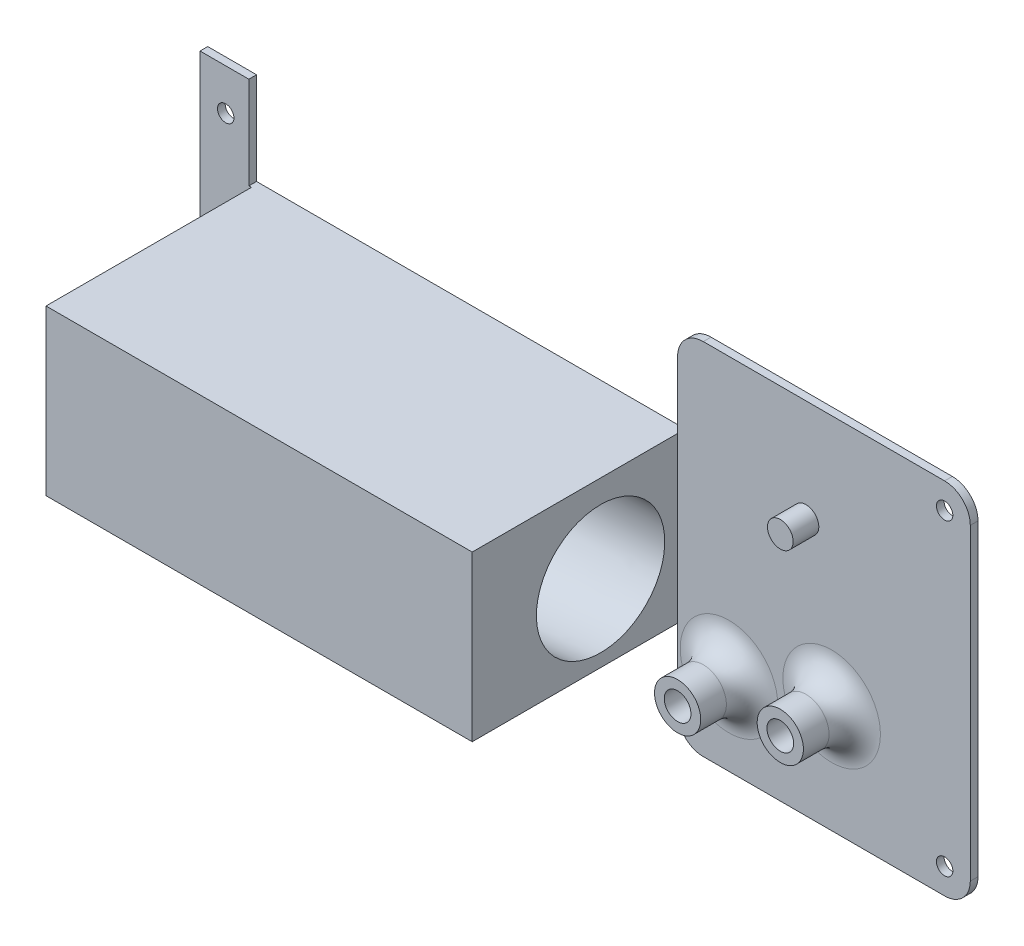
from build123d import *

# Parameters (mm, degrees)
ESQUISSE1_W             = 140
ESQUISSE1_H             = 70
BOSS_EXTRU_1_DEPTH      = 1.5
ESQUISSE2_R             = 1.6
ENL_V_MAT_EXTRU_2_DEPTH = 1.5
ESQUISSE2_4_R           = 2.5
BOSS_EXTRU_2_DEPTH      = 5
BOSS_EXTRU_3_DEPTH      = 40
ESQUISSE11_R            = 4.5
ESQUISSE11_R_2          = 2.6
BOSS_EXTRU_4_DEPTH      = 10
CONG_1_R                = 5
ESQUISSE14_W            = 83
ESQUISSE14_H            = 18
ESQUISSE14_H_2          = 20
ENL_V_MAT_EXTRU_3_DEPTH = 162.554944214
CONG_3_R                = 5
ESQUISSE17_W            = 1.5
ESQUISSE17_H            = 70
BOSS_EXTRU_5_DEPTH      = 10
ESQUISSE18_R            = 1.6
ENL_V_MAT_EXTRU_4_DEPTH = 162.554944239
ESQUISSE22_W            = 1.5
ESQUISSE22_H            = 18
ESQUISSE22_H_2          = 20
ENL_V_MAT_EXTRU_5_DEPTH = 0.5


with BuildPart() as part:
    # Esquisse1 → Boss.-Extru.1 (new body)
    with BuildSketch(Plane.XY):
        with Locations((70, -35)):
            Rectangle(ESQUISSE1_W, ESQUISSE1_H)
    extrude(amount=BOSS_EXTRU_1_DEPTH)

    # Esquisse2 → Enlèv. mat.-Extru.2 (cut)
    with BuildSketch(Plane.XY.offset(1.5)):
        with Locations((135, -5)):
            Circle(ESQUISSE2_R)
        with Locations((135, -65)):
            Circle(ESQUISSE2_R)
    extrude(amount=-ENL_V_MAT_EXTRU_2_DEPTH, mode=Mode.SUBTRACT)

    # Esquisse2<4> → Boss.-Extru.2 (add)
    with BuildSketch(Plane.XY.offset(1.5)):
        with Locations((108, -20)):
            Circle(ESQUISSE2_4_R)
    extrude(amount=BOSS_EXTRU_2_DEPTH)

    # Esquisse2<5> → Boss.-Extru.3 (add)
    with BuildSketch(Plane.XY.offset(1.5)):
        Polygon((83, -18), (0, -18), (0, -50), (7.5, -50), (75, -50), (76.464784117, -50), (83, -50), (83, -45), align=None)
    extrude(amount=BOSS_EXTRU_3_DEPTH)

    # Esquisse11 → Boss.-Extru.4 (add)
    # profile 1 of 2: a face of its own
    with BuildSketch(Plane.XY.offset(1.5)):
        with Locations((113, -49)):
            Circle(ESQUISSE11_R)
        with Locations((113, -49)):
            Circle(ESQUISSE11_R_2, mode=Mode.SUBTRACT)
    # profile 2 of 2: a face of its own
    with BuildSketch(Plane.XY.offset(1.5)):
        with Locations((93, -54)):
            Circle(ESQUISSE11_R)
        with Locations((93, -54)):
            Circle(ESQUISSE11_R_2, mode=Mode.SUBTRACT)
    extrude(amount=BOSS_EXTRU_4_DEPTH)

    # Congé1
    cong_1_edges = [part.edges().sort_by_distance(p)[0] for p in [
        (108.5, -49, 1.5),
        (88.5, -54, 1.5),
    ]]
    fillet(cong_1_edges, radius=CONG_1_R)

    # Esquisse14 → Enlèv. mat.-Extru.3 (cut, through all)
    with BuildSketch(Plane.XY.offset(1.5)):
        with Locations((41.5, -9)):
            Rectangle(ESQUISSE14_W, ESQUISSE14_H)
        with Locations((41.5, -60)):
            Rectangle(ESQUISSE14_W, ESQUISSE14_H_2)
    extrude(amount=-ENL_V_MAT_EXTRU_3_DEPTH, mode=Mode.SUBTRACT)

    # Congé3
    cong_3_edges = [part.edges().sort_by_distance(p)[0] for p in [
        (83, 0, 0.75),
        (140, 0, 0.75),
        (140, -70, 0.75),
        (83, -70, 0.75),
    ]]
    fillet(cong_3_edges, radius=CONG_3_R)

    # Enlèvement de matière-Lissage1: read off the stored shape, not the designer's step
    # Enlèvement de matière-Lissage1: loft between two sections, ruled curve by curve
    enl_vement_de_mati_re_lissage1_from = [
        Edge.make_bspline([(0, -35.358936945, 10.061683817), (0, -34.736507104, 10.005061444), (0, -34.071276467, 9.983471322), (0, -32.656620792, 10.043511569), (0, -31.906986183, 10.125212836), (0, -30.336715689, 10.432215403), (0, -29.515853558, 10.657740433), (0, -27.835171711, 11.295881241), (0, -26.97522752, 11.708928876), (0, -25.273092172, 12.759040897), (0, -24.43107638, 13.396695447), (0, -22.846227272, 14.910682395), (0, -22.104033135, 15.787505474), (0, -20.813231902, 17.754778804), (0, -20.26561628, 18.845205387), (0, -19.446047462, 21.166299645), (0, -19.174928563, 22.396203373), (0, -18.948439072, 24.885922737), (0, -18.993175694, 26.144559807), (0, -19.380457825, 28.575441159), (0, -19.722320583, 29.746783491), (0, -20.636945499, 31.91468419), (0, -21.20873673, 32.91104037), (0, -22.494376602, 34.686155378), (0, -23.207508016, 35.465281495), (0, -24.692213453, 36.805300064), (0, -25.463508496, 37.366741349), (0, -27.001451353, 38.297680084), (0, -27.768143671, 38.667624764), (0, -29.257240332, 39.252937618), (0, -29.979826835, 39.468566674), (0, -31.360426607, 39.782890995), (0, -32.018633214, 39.88169381), (0, -33.263492896, 39.994938556), (0, -33.928723533, 40.016528678), (0, -35.343379208, 39.956488431), (0, -36.093013817, 39.874787164), (0, -37.663284311, 39.567784597), (0, -38.484146442, 39.342259567), (0, -40.164828289, 38.704118759), (0, -41.02477248, 38.291071124), (0, -42.726907828, 37.240959103), (0, -43.56892362, 36.603304553), (0, -45.153772728, 35.089317605), (0, -45.895966865, 34.212494526), (0, -47.186768098, 32.245221196), (0, -47.73438372, 31.154794613), (0, -48.553952538, 28.833700355), (0, -48.825071437, 27.603796627), (0, -49.051560928, 25.114077263), (0, -49.006824306, 23.855440193), (0, -48.619542175, 21.424558841), (0, -48.277679417, 20.253216509), (0, -47.363054501, 18.08531581), (0, -46.79126327, 17.08895963), (0, -45.505623398, 15.313844622), (0, -44.792491984, 14.534718505), (0, -43.307786547, 13.194699936), (0, -42.536491504, 12.633258651), (0, -40.998548647, 11.702319916), (0, -40.231856329, 11.332375236), (0, -38.742759668, 10.747062382), (0, -38.020173165, 10.531433326), (0, -36.639573393, 10.217109005), (0, -35.981366786, 10.11830619), (0, -35.358936945, 10.061683817)], [0, 0, 0, 0, 0.03125, 0.03125, 0.0625, 0.0625, 0.09375, 0.09375, 0.125, 0.125, 0.15625, 0.15625, 0.1875, 0.1875, 0.21875, 0.21875, 0.25, 0.25, 0.28125, 0.28125, 0.3125, 0.3125, 0.34375, 0.34375, 0.375, 0.375, 0.40625, 0.40625, 0.4375, 0.4375, 0.46875, 0.46875, 0.5, 0.5, 0.53125, 0.53125, 0.5625, 0.5625, 0.59375, 0.59375, 0.625, 0.625, 0.65625, 0.65625, 0.6875, 0.6875, 0.71875, 0.71875, 0.75, 0.75, 0.78125, 0.78125, 0.8125, 0.8125, 0.84375, 0.84375, 0.875, 0.875, 0.90625, 0.90625, 0.9375, 0.9375, 0.96875, 0.96875, 1, 1, 1, 1], 3),
    ]
    enl_vement_de_mati_re_lissage1_to = [
        Edge.make_bspline([(83, -36.978683165, 4.157601006), (83, -36.46441654, 4.075155874), (83, -35.912574895, 4.019404171), (83, -34.733027399, 3.988933266), (83, -34.105143284, 4.014261099), (83, -32.782184956, 4.18027026), (83, -32.086909931, 4.321124739), (83, -30.653339337, 4.756165981), (83, -29.914915742, 5.050704715), (83, -28.440098529, 5.827037097), (83, -27.703817174, 6.30933137), (83, -26.300151244, 7.477991211), (83, -25.633270194, 8.16480105), (83, -24.448315736, 9.727029605), (83, -23.931067977, 10.602484983), (83, -23.117787224, 12.485655838), (83, -22.82249127, 13.492783585), (83, -22.492710742, 15.549850084), (83, -22.458382278, 16.598815077), (83, -22.642231037, 18.641841677), (83, -22.85989188, 19.635114611), (83, -23.497113975, 21.489467093), (83, -23.915879492, 22.35032337), (83, -24.883881149, 23.899199305), (83, -25.432500118, 24.587483568), (83, -26.590728024, 25.785935025), (83, -27.200073831, 26.296542663), (83, -28.425809001, 27.15791298), (83, -29.04220995, 27.509050012), (83, -30.246974936, 28.080293485), (83, -30.835475596, 28.300627173), (83, -31.965435919, 28.640407161), (83, -32.50705021, 28.759953862), (83, -33.53558346, 28.924844126), (83, -34.087425105, 28.980595829), (83, -35.266972601, 29.011066734), (83, -35.894856716, 28.985738901), (83, -37.217815044, 28.81972974), (83, -37.913090069, 28.678875261), (83, -39.346660663, 28.243834019), (83, -40.085084258, 27.949295285), (83, -41.559901471, 27.172962903), (83, -42.296182826, 26.69066863), (83, -43.699848756, 25.522008789), (83, -44.366729806, 24.83519895), (83, -45.551684264, 23.272970395), (83, -46.068932023, 22.397515017), (83, -46.882212776, 20.514344162), (83, -47.17750873, 19.507216415), (83, -47.507289258, 17.450149916), (83, -47.541617722, 16.401184923), (83, -47.357768963, 14.358158323), (83, -47.14010812, 13.364885389), (83, -46.502886025, 11.510532907), (83, -46.084120508, 10.64967663), (83, -45.116118851, 9.100800695), (83, -44.567499882, 8.412516432), (83, -43.409271976, 7.214064975), (83, -42.799926169, 6.703457337), (83, -41.574190999, 5.84208702), (83, -40.95779005, 5.490949988), (83, -39.753025064, 4.919706515), (83, -39.164524404, 4.699372827), (83, -38.034564081, 4.359592839), (83, -37.49294979, 4.240046138), (83, -36.978683165, 4.157601006)], [0, 0, 0, 0, 0.03125, 0.03125, 0.0625, 0.0625, 0.09375, 0.09375, 0.125, 0.125, 0.15625, 0.15625, 0.1875, 0.1875, 0.21875, 0.21875, 0.25, 0.25, 0.28125, 0.28125, 0.3125, 0.3125, 0.34375, 0.34375, 0.375, 0.375, 0.40625, 0.40625, 0.4375, 0.4375, 0.46875, 0.46875, 0.5, 0.5, 0.53125, 0.53125, 0.5625, 0.5625, 0.59375, 0.59375, 0.625, 0.625, 0.65625, 0.65625, 0.6875, 0.6875, 0.71875, 0.71875, 0.75, 0.75, 0.78125, 0.78125, 0.8125, 0.8125, 0.84375, 0.84375, 0.875, 0.875, 0.90625, 0.90625, 0.9375, 0.9375, 0.96875, 0.96875, 1, 1, 1, 1], 3),
    ]
    enl_vement_de_mati_re_lissage1 = Solid(Shell([*[Face.make_surface_from_curves(enl_vement_de_mati_re_lissage1_from[k], enl_vement_de_mati_re_lissage1_to[k]) for k in range(1)], Face(Wire(enl_vement_de_mati_re_lissage1_from)), Face(Wire(enl_vement_de_mati_re_lissage1_to))]))
    add(enl_vement_de_mati_re_lissage1, mode=Mode.SUBTRACT)

    # Esquisse17 → Boss.-Extru.5 (add)
    with BuildSketch(Plane.ZY):
        with Locations((0.75, -35)):
            Rectangle(ESQUISSE17_W, ESQUISSE17_H)
    extrude(amount=BOSS_EXTRU_5_DEPTH)

    # Esquisse18 → Enlèv. mat.-Extru.4 (cut, through all)
    with BuildSketch(Plane.XY.offset(1.5)):
        with Locations((-5, -8)):
            Circle(ESQUISSE18_R)
        with Locations((-5, -62)):
            Circle(ESQUISSE18_R)
    extrude(amount=-ENL_V_MAT_EXTRU_4_DEPTH, mode=Mode.SUBTRACT)

    # Esquisse22 → Enlèv. mat.-Extru.5 (cut)
    with BuildSketch(Plane(origin=(0, 0, 0), x_dir=(0, 0, -1), z_dir=(1, 0, 0))):
        with Locations((-0.75, -9)):
            Rectangle(ESQUISSE22_W, ESQUISSE22_H)
        with Locations((-0.75, -60)):
            Rectangle(ESQUISSE22_W, ESQUISSE22_H_2)
    extrude(amount=-ENL_V_MAT_EXTRU_5_DEPTH, mode=Mode.SUBTRACT)


solid = part.part
